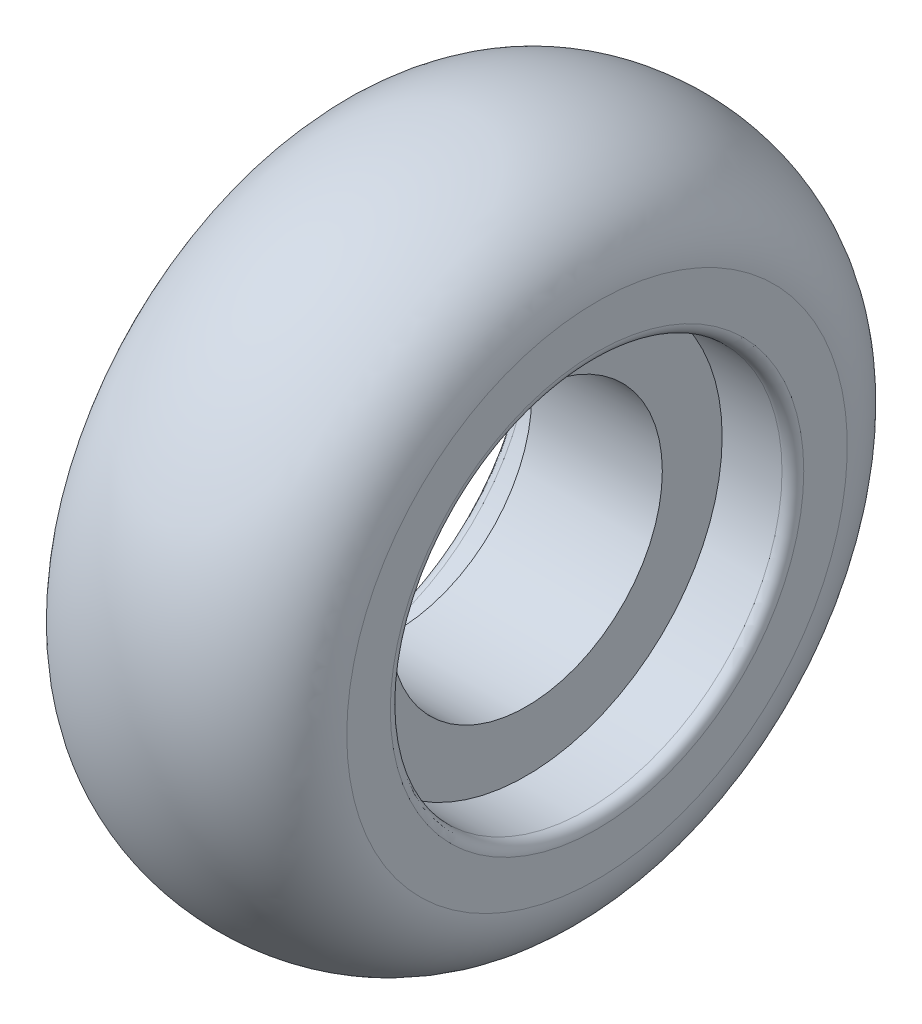
from build123d import *


with BuildPart() as part:
    # Szkic1 → Obrót1 (revolve)
    with BuildSketch(Plane.XY):
        with BuildLine():
            Line((-6, 12.5), (6, 12.5))
            Line((6, 12.5), (6, 18))
            Line((6, 18), (11.5, 18))
            ThreePointArc((11.5, 18), (12.207106781, 18.292893219), (12.5, 19))
            Line((12.5, 19), (12.5, 23))
            add(Edge.make_bspline(
                [(12.5, 23), (12.5, 31.5), (0, 31.5), (-12.5, 31.5), (-12.5, 23)],
                knots=[0, 0, 0, 1.570796327, 1.570796327, 3.141592654, 3.141592654, 3.141592654], degree=2, weights=[1, 0.707106781, 1, 0.707106781, 1]))
            Line((-12.5, 23), (-12.5, 19))
            ThreePointArc((-12.5, 19), (-12.207106781, 18.292893219), (-11.5, 18))
            Line((-11.5, 18), (-6, 18))
            Line((-6, 18), (-6, 12.5))
        make_face()
    revolve(axis=Axis((0, 0, 0), (1, 0, 0)))


solid = part.part
